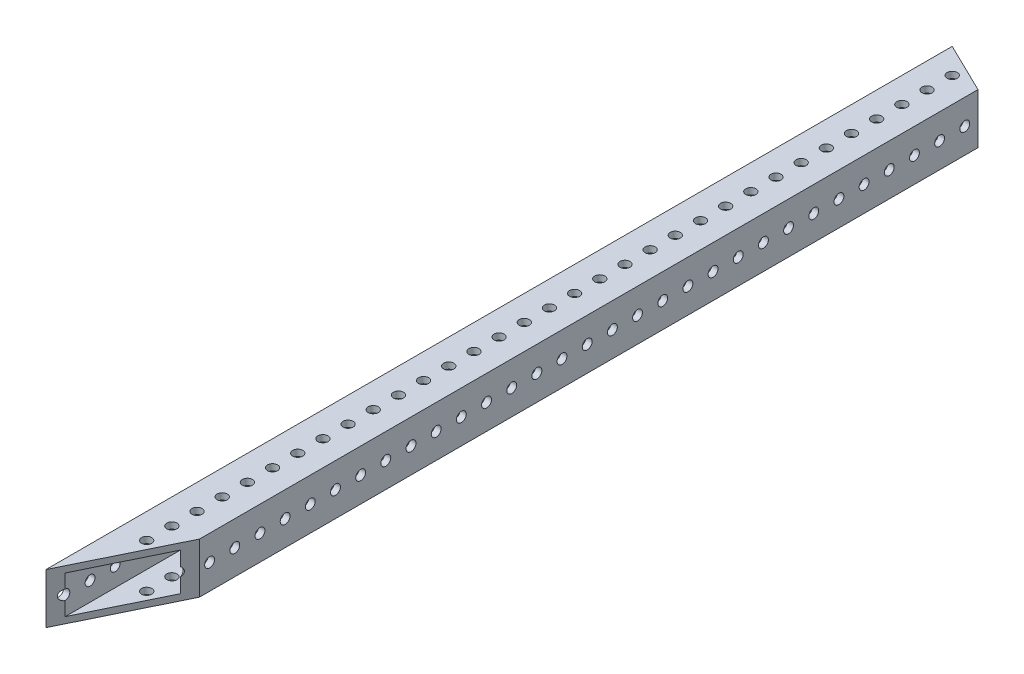
from build123d import *

# Parameters (mm, degrees)
SKETCH1_W           = 25.4
SKETCH1_H           = 25.4
SKETCH1_W_2         = 19.05
SKETCH1_H_2         = 19.05
BOSS_EXTRUDE1_DEPTH = 228.6
SKETCH2_R           = 2.5527
CUT_EXTRUDE1_DEPTH  = 231.35713577
SKETCH4_R           = 2.4892
CUT_EXTRUDE3_DEPTH  = 231.35713577
CUT_EXTRUDE4_DEPTH  = 231.35713577
CUT_EXTRUDE5_DEPTH  = 231.35713577


with BuildPart() as part:
    # Sketch1 → Boss-Extrude1 (new, symmetric)
    with BuildSketch(Plane.XY):
        Rectangle(SKETCH1_W, SKETCH1_H)
        Rectangle(SKETCH1_W_2, SKETCH1_H_2, mode=Mode.SUBTRACT)
    extrude(amount=BOSS_EXTRUDE1_DEPTH, both=True)

    # Sketch2 → Cut-Extrude1 (cut, through all)
    with BuildSketch(Plane(origin=(0, 12.7, 0), x_dir=(1, 0, 0), z_dir=(0, 1, 0))):
        with Locations((0, -266.7)):
            Circle(SKETCH2_R)
        with Locations((0, -254)):
            Circle(SKETCH2_R)
        with Locations((0, -241.3)):
            Circle(SKETCH2_R)
        with Locations((0, -190.5)):
            Circle(SKETCH2_R)
        with Locations((0, -177.8)):
            Circle(SKETCH2_R)
        with Locations((0, -165.1)):
            Circle(SKETCH2_R)
        with Locations((0, -152.4)):
            Circle(SKETCH2_R)
        with Locations((0, -139.7)):
            Circle(SKETCH2_R)
        with Locations((0, -127)):
            Circle(SKETCH2_R)
        with Locations((0, -114.3)):
            Circle(SKETCH2_R)
        with Locations((0, -101.6)):
            Circle(SKETCH2_R)
        with Locations((0, -88.9)):
            Circle(SKETCH2_R)
        with Locations((0, -76.2)):
            Circle(SKETCH2_R)
        with Locations((0, -63.5)):
            Circle(SKETCH2_R)
        with Locations((0, -50.8)):
            Circle(SKETCH2_R)
        with Locations((0, -38.1)):
            Circle(SKETCH2_R)
        with Locations((0, -25.4)):
            Circle(SKETCH2_R)
        with Locations((0, -12.7)):
            Circle(SKETCH2_R)
        Circle(SKETCH2_R)
        with Locations((0, 12.7)):
            Circle(SKETCH2_R)
        with Locations((0, 25.4)):
            Circle(SKETCH2_R)
        with Locations((0, 38.1)):
            Circle(SKETCH2_R)
        with Locations((0, 50.8)):
            Circle(SKETCH2_R)
        with Locations((0, 63.5)):
            Circle(SKETCH2_R)
        with Locations((0, 76.2)):
            Circle(SKETCH2_R)
        with Locations((0, 88.9)):
            Circle(SKETCH2_R)
        with Locations((0, 101.6)):
            Circle(SKETCH2_R)
        with Locations((0, 114.3)):
            Circle(SKETCH2_R)
        with Locations((0, 127)):
            Circle(SKETCH2_R)
        with Locations((0, 139.7)):
            Circle(SKETCH2_R)
        with Locations((0, 152.4)):
            Circle(SKETCH2_R)
        with Locations((0, 165.1)):
            Circle(SKETCH2_R)
        with Locations((0, 177.8)):
            Circle(SKETCH2_R)
        with Locations((0, 190.5)):
            Circle(SKETCH2_R)
        with Locations((0, 203.2)):
            Circle(SKETCH2_R)
        with Locations((0, 215.9)):
            Circle(SKETCH2_R)
        with Locations((0, 228.6)):
            Circle(SKETCH2_R)
        with Locations((0, 241.3)):
            Circle(SKETCH2_R)
        with Locations((0, 254)):
            Circle(SKETCH2_R)
        with Locations((0, 266.7)):
            Circle(SKETCH2_R)
        with Locations((0, 279.4)):
            Circle(SKETCH2_R)
        with Locations((0, 292.1)):
            Circle(SKETCH2_R)
    extrude(amount=-CUT_EXTRUDE1_DEPTH, mode=Mode.SUBTRACT)

    # Sketch4 → Cut-Extrude3 (cut, through all)
    with BuildSketch(Plane(origin=(12.7, 0, 0), x_dir=(0, 0, -1), z_dir=(1, 0, 0))):
        with Locations((-222.25, 0)):
            Circle(SKETCH4_R)
        with Locations((-209.55, 0)):
            Circle(SKETCH4_R)
        with Locations((-196.85, 0)):
            Circle(SKETCH4_R)
        with Locations((-184.15, 0)):
            Circle(SKETCH4_R)
        with Locations((-171.45, 0)):
            Circle(SKETCH4_R)
        with Locations((209.55, 0)):
            Circle(SKETCH4_R)
        with Locations((222.25, 0)):
            Circle(SKETCH4_R)
        with Locations((234.95, 0)):
            Circle(SKETCH4_R)
        with Locations((247.65, 0)):
            Circle(SKETCH4_R)
        with Locations((260.35, 0)):
            Circle(SKETCH4_R)
        with Locations((273.05, 0)):
            Circle(SKETCH4_R)
        with Locations((285.75, 0)):
            Circle(SKETCH4_R)
        with Locations((298.45, 0)):
            Circle(SKETCH4_R)
        with Locations((311.15, 0)):
            Circle(SKETCH4_R)
        with Locations((323.85, 0)):
            Circle(SKETCH4_R)
        with Locations((336.55, 0)):
            Circle(SKETCH4_R)
        with Locations((349.25, 0)):
            Circle(SKETCH4_R)
        with Locations((361.95, 0)):
            Circle(SKETCH4_R)
        with Locations((374.65, 0)):
            Circle(SKETCH4_R)
        with Locations((-158.75, 0)):
            Circle(SKETCH4_R)
        with Locations((-146.05, 0)):
            Circle(SKETCH4_R)
        with Locations((-133.35, 0)):
            Circle(SKETCH4_R)
        with Locations((-120.65, 0)):
            Circle(SKETCH4_R)
        with Locations((-107.95, 0)):
            Circle(SKETCH4_R)
        with Locations((-95.25, 0)):
            Circle(SKETCH4_R)
        with Locations((-82.55, 0)):
            Circle(SKETCH4_R)
        with Locations((-69.85, 0)):
            Circle(SKETCH4_R)
        with Locations((-57.15, 0)):
            Circle(SKETCH4_R)
        with Locations((-44.45, 0)):
            Circle(SKETCH4_R)
        with Locations((-31.75, 0)):
            Circle(SKETCH4_R)
        with Locations((-19.05, 0)):
            Circle(SKETCH4_R)
        with Locations((-6.35, 0)):
            Circle(SKETCH4_R)
        with Locations((6.35, 0)):
            Circle(SKETCH4_R)
        with Locations((19.05, 0)):
            Circle(SKETCH4_R)
        with Locations((31.75, 0)):
            Circle(SKETCH4_R)
        with Locations((44.45, 0)):
            Circle(SKETCH4_R)
        with Locations((57.15, 0)):
            Circle(SKETCH4_R)
        with Locations((69.85, 0)):
            Circle(SKETCH4_R)
        with Locations((82.55, 0)):
            Circle(SKETCH4_R)
        with Locations((95.25, 0)):
            Circle(SKETCH4_R)
        with Locations((107.95, 0)):
            Circle(SKETCH4_R)
        with Locations((120.65, 0)):
            Circle(SKETCH4_R)
        with Locations((133.35, 0)):
            Circle(SKETCH4_R)
        with Locations((146.05, 0)):
            Circle(SKETCH4_R)
        with Locations((158.75, 0)):
            Circle(SKETCH4_R)
        with Locations((171.45, 0)):
            Circle(SKETCH4_R)
        with Locations((184.15, 0)):
            Circle(SKETCH4_R)
        with Locations((196.85, 0)):
            Circle(SKETCH4_R)
    extrude(amount=-CUT_EXTRUDE3_DEPTH, mode=Mode.SUBTRACT)

    # Sketch6 → Cut-Extrude4 (cut, through all)
    with BuildSketch(Plane(origin=(0, 12.7, 0), x_dir=(1, 0, 0), z_dir=(0, 1, 0))):
        Polygon((-12.7, -228.6), (12.7, -176.522282424), (12.7, -228.6), align=None)
    extrude(amount=-CUT_EXTRUDE4_DEPTH, mode=Mode.SUBTRACT)

    # Sketch7 → Cut-Extrude5 (cut, through all)
    with BuildSketch(Plane(origin=(0, 12.7, 0), x_dir=(1, 0, 0), z_dir=(0, 1, 0))):
        Polygon((-12.7, 228.6), (12.7, 216.21159225), (12.7, 228.6), align=None)
    extrude(amount=-CUT_EXTRUDE5_DEPTH, mode=Mode.SUBTRACT)


solid = part.part
